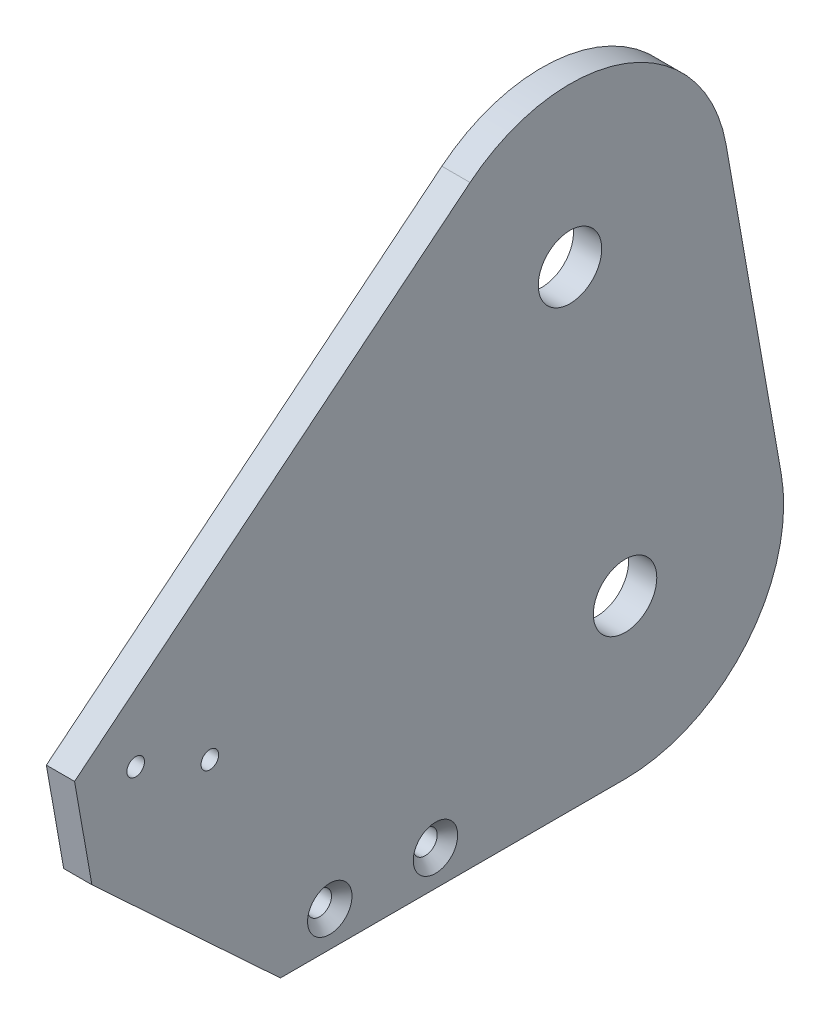
from build123d import *

# Parameters (mm, degrees)
BOSS_EXTRUDE1_DEPTH                             = 4
HOLE1_D                                         = 9
HOLE1_DEPTH                                     = 100
HOLE2_D                                         = 2.5
HOLE2_DEPTH                                     = 100
CSK_FOR_M3_FLAT_HEAD_MACHINE_SCREW1_D           = 3.4
CSK_FOR_M3_FLAT_HEAD_MACHINE_SCREW1_CSINK_D     = 6.3
CSK_FOR_M3_FLAT_HEAD_MACHINE_SCREW1_CSINK_ANGLE = 90


with BuildPart() as part:
    # Sketch2 → Boss-Extrude1 (new body)
    with BuildSketch(Plane(origin=(25, 0, 0), x_dir=(0, 0, -1), z_dir=(1, 0, 0))):
        with BuildLine():
            Line((41.240763613, 127.981290827), (49.054931608, 83.664941942))
            ThreePointArc((49.054931608, 83.664941942), (44.132757136, 65.295136726), (26.896757165, 57.257857944))
            Line((26.896757165, 57.257857944), (-22, 57.257857944))
            Line((-22, 57.257857944), (-48.74840947, 82.082529594))
            Line((-48.74840947, 82.082529594), (-51.205531184, 96.017559299))
            Line((-51.205531184, 96.017559299), (4.905862675, 141.546196581))
            ThreePointArc((4.905862675, 141.546196581), (26.951994794, 145.153164468), (41.240763613, 127.981290827))
        make_face()
    extrude(amount=BOSS_EXTRUDE1_DEPTH)

    # Hole1
    with Locations(Plane.ZY.offset(-25)):
        with Locations((-19.08258917, 124.07420683), (-26.896757165, 79.757857944)):
            Hole(HOLE1_D / 2, depth=HOLE1_DEPTH)

    # Hole2
    with Locations(Plane.ZY.offset(-25)):
        with Locations((42.533995674, 93.484878527), (32.011904953, 89.095333351)):
            Hole(HOLE2_D / 2, depth=HOLE2_DEPTH)

    # CSK for M3 Flat Head Machine Screw1 (through all)
    with Locations(Plane(origin=(29, 0, 0), x_dir=(0, 0, -1), z_dir=(1, 0, 0))):
        with Locations((0, 62.257857944), (-15, 62.257857944)):
            CounterSinkHole(CSK_FOR_M3_FLAT_HEAD_MACHINE_SCREW1_D / 2, CSK_FOR_M3_FLAT_HEAD_MACHINE_SCREW1_CSINK_D / 2, counter_sink_angle=CSK_FOR_M3_FLAT_HEAD_MACHINE_SCREW1_CSINK_ANGLE)


solid = part.part
